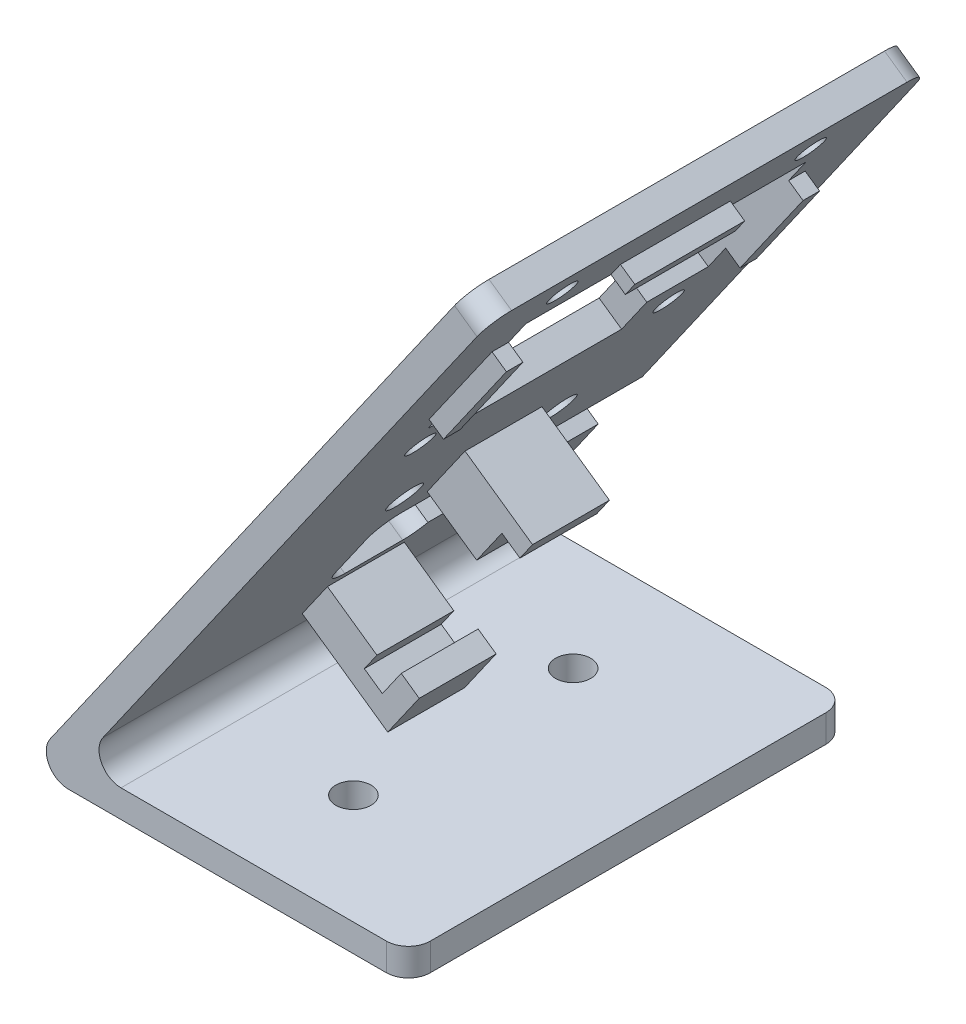
from build123d import *

# Parameters (mm, degrees)
BOSS_EXTRUDE1_DEPTH      = 40
SKETCH2_R                = 1.25
SKETCH2_R_2              = 1.5
SKETCH2_W                = 9
SKETCH2_H                = 9
SKETCH2_W_2              = 15.5
SKETCH2_H_2              = 7
CUT_EXTRUDE2_DEPTH       = 5
SKETCH4_W                = 7
SKETCH4_H                = 4
SKETCH4_H_2              = 2
BOSS_EXTRUDE2_DEPTH      = 5.5
SKETCH6_W                = 7
SKETCH6_H                = 2
BOSS_EXTRUDE3_DEPTH      = 7.5
BOSS_EXTRUDE4_DEPTH      = 3
BOSS_EXTRUDE4_DEPTH_BACK = 2
SKETCH10_W               = 1.5
SKETCH10_H               = 10
SKETCH10_W_2             = 10
SKETCH10_H_2             = 1.5
BOSS_EXTRUDE6_DEPTH      = 1.6
SKETCH5_R                = 1.6
CUT_EXTRUDE3_DEPTH       = 10
FILLET1_R                = 2


with BuildPart() as part:
    # Sketch1 → Boss-Extrude1 (new body)
    with BuildSketch(Plane.XY):
        Polygon((0, 0), (37.395775338, 53.406702009), (35.347895227, 54.8406431), (-4.802455317, -2.5), (0, -2.5), (30, -2.5), (30, 0), align=None)
    extrude(amount=BOSS_EXTRUDE1_DEPTH)

    # Sketch2 → Cut-Extrude2 (cut)
    with BuildSketch(Plane(origin=(-2.047880111, 1.433941091, 0), x_dir=(0, 0, 1), z_dir=(-0.8191520442889935, 0.5735764363510438, 0))):
        Polygon((26.85, 42.812544683), (32.75, 42.812544683), (32.75, 58.312544683), (7.25, 58.312544683), (7.25, 42.812544683), (12.85, 42.812544683), (12.85, 38.812544683), (26.85, 38.812544683), align=None)
        with Locations(Location((8.7, 39.047544683, 0), (0, 0, 270))):
            Circle(SKETCH2_R)
        with Locations(Location((31.3, 39.047544683, 0), (0, 0, 270))):
            Circle(SKETCH2_R)
        with Locations(Location((8.7, 61.577544683, 0), (0, 0, 270))):
            Circle(SKETCH2_R)
        with Locations(Location((31.3, 61.577544683, 0), (0, 0, 270))):
            Circle(SKETCH2_R)
        with Locations(Location((10.8, 25.197544683, 0), (0, 0, 270))):
            Circle(SKETCH2_R_2)
        with Locations(Location((24.8, 25.197544683, 0), (0, 0, 270))):
            Circle(SKETCH2_R_2)
        with Locations((20, 16.197544683)):
            Rectangle(SKETCH2_W, SKETCH2_H)
        with Locations((7.75, 16.197544683)):
            Rectangle(SKETCH2_W_2, SKETCH2_H_2)
    extrude(amount=-CUT_EXTRUDE2_DEPTH, mode=Mode.SUBTRACT)

    # Sketch4 → Boss-Extrude2 (add)
    with BuildSketch(Plane(origin=(0, 0, 0), x_dir=(0, 0, -1), z_dir=(0.8191520442889932, -0.5735764363510439, 0))):
        with Locations((-17.8, 24.697544683)):
            Rectangle(SKETCH4_W, SKETCH4_H)
        with Locations((-20, 9.697544683)):
            Rectangle(SKETCH4_W, SKETCH4_H_2)
    extrude(amount=BOSS_EXTRUDE2_DEPTH)

    # Sketch6 → Boss-Extrude3 (add)
    with BuildSketch(Plane(origin=(0, 0, 0), x_dir=(0, 0, -1), z_dir=(0.8191520442889932, -0.5735764363510439, 0))):
        with Locations((-17.8, 27.697544683)):
            Rectangle(SKETCH6_W, SKETCH6_H)
        with Locations((-20, 7.697544683)):
            Rectangle(SKETCH6_W, SKETCH6_H)
    extrude(amount=BOSS_EXTRUDE3_DEPTH)

    # Sketch8 → Boss-Extrude4 (add, two sides: drawn at the far end of the back side and taken through both)
    with BuildSketch(Plane(origin=(4.988706684, 7.124611507, 21.197544683), x_dir=(0.671010071662837, -0.4698463103929531, -0.5735764363510439), z_dir=(0.5735764363510439, 0.8191520442889935, 0)).offset(-BOSS_EXTRUDE4_DEPTH_BACK)):
        Polygon((8.838041271, -0.453819943), (4.823006216, -6.187884253), (6.461310305, -7.335037125), (10.476345359, -1.600972815), align=None)
    extrude(amount=BOSS_EXTRUDE4_DEPTH + BOSS_EXTRUDE4_DEPTH_BACK)

    # Sketch10 → Boss-Extrude6 (add)
    with BuildSketch(Plane(origin=(0, 0, 0), x_dir=(0, 0, -1), z_dir=(0.8191520442889934, -0.5735764363510439, 0))):
        with Locations((-33.5, 50.562544683)):
            Rectangle(SKETCH10_W, SKETCH10_H)
        with Locations((-6.5, 50.562544683)):
            Rectangle(SKETCH10_W, SKETCH10_H)
        with Locations((-20, 59.062544683)):
            Rectangle(SKETCH10_W_2, SKETCH10_H_2)
    extrude(amount=BOSS_EXTRUDE6_DEPTH)

    # Sketch5 → Cut-Extrude3 (cut)
    with BuildSketch(Plane(origin=(0, 0, 0), x_dir=(1, 0, 0), z_dir=(0, 1, 0))):
        with Locations(Location((15, -10, 0), (0, 0, 270))):
            Circle(SKETCH5_R)
        with Locations(Location((15, -30, 0), (0, 0, 270))):
            Circle(SKETCH5_R)
    extrude(amount=-CUT_EXTRUDE3_DEPTH, mode=Mode.SUBTRACT)

    # Fillet1
    # the kernel refuses this fillet: 2 mm, written as the material it adds along each edge
    with BuildSketch(Plane(origin=(0, 0, 0), x_dir=(0.5735764363510439, 0.8191520442889934, 0), z_dir=(0, 0, 1))) as fillet1_piece_1:
        with BuildLine():
            CenterArc((FILLET1_R * 1.92098212697, -FILLET1_R), FILLET1_R, 90, 125)
            Line((FILLET1_R * 1.10183008268, -FILLET1_R * 1.57357643635), (0, 0))
            Line((0, 0), (FILLET1_R * 1.92098212697, 0))
        make_face()
    extrude(amount=40)
    with BuildSketch(Plane(origin=(9.82374381, 18.388377129, 24.5), x_dir=(-0.5735764363510438, -0.8191520442889935, 0), z_dir=(0.8191520442889935, -0.5735764363510438, 0)), Plane(origin=(4.661555882, 11.016008731, 24.5), x_dir=(0, 0, -1), z_dir=(0.8191520442889935, -0.5735764363510438, 0))) as fillet1_piece_2:
        with BuildLine():
            CenterArc((FILLET1_R, FILLET1_R), FILLET1_R, 180, 90)
            Line((0, FILLET1_R), (0, 0))
            Line((0, 0), (FILLET1_R, 0))
        make_face()
    extrude(amount=2.5)
    with BuildSketch(Plane(origin=(4.661555882, 11.016008731, 15.5), x_dir=(0.5735764363510438, 0.8191520442889935, 7.105427357600794e-14), z_dir=(0.8191520442889935, -0.5735764363510438, 0))) as fillet1_piece_3:
        with BuildLine():
            CenterArc((2, 1.732050808), FILLET1_R, 180, 60)
            Line((0, 1.732050808), (0, 0))
            Line((0, 0), (1, 0))
        make_face()
    extrude(amount=2.5)
    with BuildSketch(Plane(origin=(9.82374381, 18.388377129, 15.5), x_dir=(0, 0, 1), z_dir=(0.8191520442889935, -0.5735764363510438, 0))) as fillet1_piece_4:
        with BuildLine():
            CenterArc((1.732050808, 2), FILLET1_R, 210, 60)
            Line((0, 1), (0, 0))
            Line((0, 0), (1.732050808, 0))
        make_face()
    extrude(amount=2.5)
    # the kernel refuses this fillet: 2 mm, written as the material it takes off along each edge
    with BuildSketch(Plane(origin=(41.491535559, 50.538819828, 40), x_dir=(0, 0, -1), z_dir=(-0.8191520442889935, 0.5735764363510437, 0)), Plane(origin=(30, -7.5, 0), x_dir=(-1, 0, 0), z_dir=(0, 1, 0)), Plane(origin=(41.491535559, 50.538819828, 0), x_dir=(-0.5735764363510438, -0.8191520442889935, 0), z_dir=(-0.8191520442889935, 0.5735764363510437, 0))) as fillet1_2_piece_1:
        with BuildLine():
            CenterArc((FILLET1_R, FILLET1_R), FILLET1_R, 180, 90)
            Line((0, FILLET1_R), (0, 0))
            Line((0, 0), (FILLET1_R, 0))
        make_face()
    extrude(amount=12.5, mode=Mode.SUBTRACT)
    with BuildSketch(Plane(origin=(-4.802455317, -2.5, -9.604910635), x_dir=(1, 0, 0), z_dir=(0, 0, 1))) as fillet1_2_piece_2:
        with BuildLine():
            CenterArc((FILLET1_R * 1.92098212697, FILLET1_R), FILLET1_R, 145, 125)
            Line((FILLET1_R * 1.10183008268, FILLET1_R * 1.57357643635), (0, 0))
            Line((0, 0), (FILLET1_R * 1.92098212697, 0))
        make_face()
    extrude(amount=59.20982127, mode=Mode.SUBTRACT)
    with BuildSketch(Plane(origin=(30, -7.5, 40), x_dir=(-1, 0, 0), z_dir=(0, 1, 0))) as fillet1_2_piece_3:
        with BuildLine():
            CenterArc((FILLET1_R, -FILLET1_R), FILLET1_R, 90, 90)
            Line((0, -FILLET1_R), (0, 0))
            Line((0, 0), (FILLET1_R, 0))
        make_face()
    extrude(amount=12.5, mode=Mode.SUBTRACT)


solid = part.part
